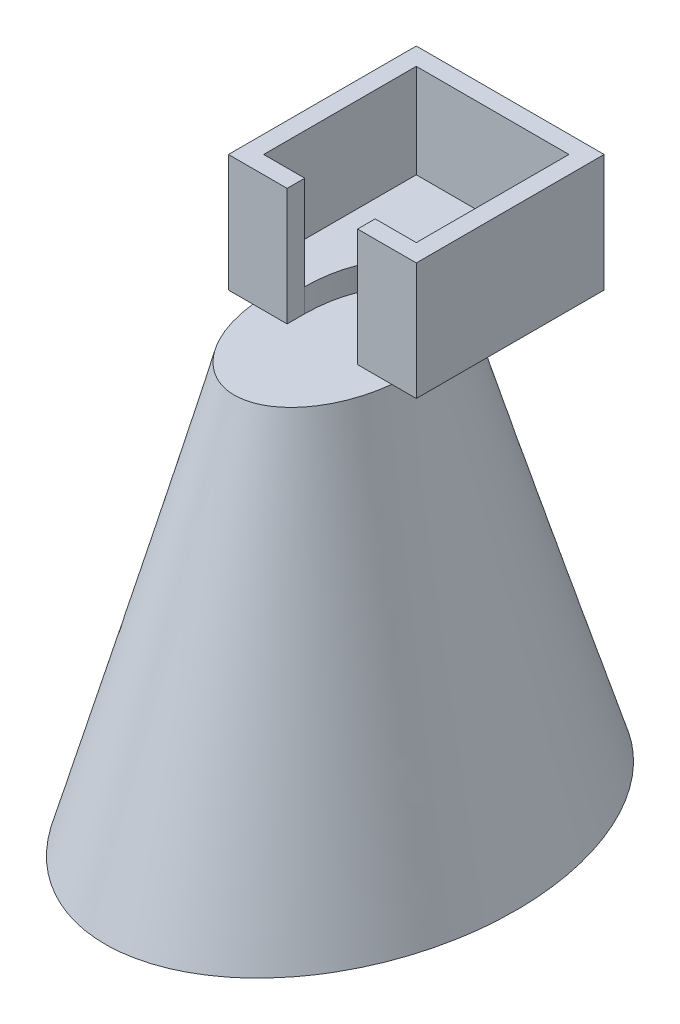
from build123d import *

# Parameters (mm, degrees)
ESQUISSE1_W             = 16
ESQUISSE1_H             = 16
BOSS_EXTRU_1_DEPTH      = 10
ESQUISSE2_W             = 13
ESQUISSE2_H             = 13
ENL_V_MAT_EXTRU_1_DEPTH = 8
ESQUISSE3_W             = 3
ESQUISSE3_H             = 1.5
ENL_V_MAT_EXTRU_2_DEPTH = 20
ESQUISSE4_RX            = 6
ESQUISSE4_RY            = 3
ENL_V_MAT_EXTRU_4_DEPTH = 20


with BuildPart() as part:
    # Esquisse1 → Boss.-Extru.1 (new body)
    with BuildSketch(Plane(origin=(0, 0, 0), x_dir=(1, 0, 0), z_dir=(0, 1, 0))):
        Rectangle(ESQUISSE1_W, ESQUISSE1_H)
    extrude(amount=BOSS_EXTRU_1_DEPTH)

    # Esquisse2 → Enlèv. mat.-Extru.1 (cut)
    with BuildSketch(Plane(origin=(0, 10, 0), x_dir=(1, 0, 0), z_dir=(0, 1, 0))):
        Rectangle(ESQUISSE2_W, ESQUISSE2_H)
    extrude(amount=-ENL_V_MAT_EXTRU_1_DEPTH, mode=Mode.SUBTRACT)

    # Esquisse3 → Enlèv. mat.-Extru.2 (cut)
    with BuildSketch(Plane(origin=(0, 0, 0), x_dir=(1, 0, 0), z_dir=(0, 1, 0))):
        with Locations((1.5, -7.25)):
            Rectangle(ESQUISSE3_W, ESQUISSE3_H)
        with Locations((-1.5, -7.25)):
            Rectangle(ESQUISSE3_W, ESQUISSE3_H)
    extrude(amount=ENL_V_MAT_EXTRU_2_DEPTH, mode=Mode.SUBTRACT)

    # Esquisse4 → Enlèv. mat.-Extru.4 (cut)
    with BuildSketch(Plane(origin=(0, 0, 0), x_dir=(-1, 0, 0), z_dir=(0, -1, 0))):
        with Locations(Location((0, -6.5), (0, 0, -90))):
            Ellipse(ESQUISSE4_RX, ESQUISSE4_RY)
    extrude(amount=-ENL_V_MAT_EXTRU_4_DEPTH, mode=Mode.SUBTRACT)

    # Lissage1: read off the stored shape, not the designer's step
    # Lissage1: loft between two sections, ruled curve by curve
    lissage1_from = [
        Edge.make_bspline([(-9.64823024, -35, -8.813706467), (-32.61878994, -35, 16.914907507), (-13.32232946, -35, 47.54232044), (9.64823024, -35, 21.813706467), (32.61878994, -35, -3.914907507), (13.32232946, -35, -34.54232044), (-9.64823024, -35, -8.813706467)], [0, 0, 0, 0, 0.5, 0.5, 0.5, 1, 1, 1, 1], 3, [1, 0.333333333, 0.333333333, 1, 0.333333333, 0.333333333, 1]),
    ]
    lissage1_to = [
        Edge.make_bspline([(-4.994047643, 0, 1.511628691), (-11.645209388, 0, 16.493771621), (-1.657114102, 0, 26.470514238), (4.994047643, 0, 11.488371309), (11.645209388, 0, -3.493771621), (1.657114102, 0, -13.470514238), (-4.994047643, 0, 1.511628691)], [0, 0, 0, 0, 0.5, 0.5, 0.5, 1, 1, 1, 1], 3, [1, 0.333333333, 0.333333333, 1, 0.333333333, 0.333333333, 1]),
    ]
    lissage1 = Solid(Shell([*[Face.make_surface_from_curves(lissage1_from[k], lissage1_to[k]) for k in range(1)], Face(Wire(lissage1_from)), Face(Wire(lissage1_to))]))
    add(lissage1)


solid = part.part
